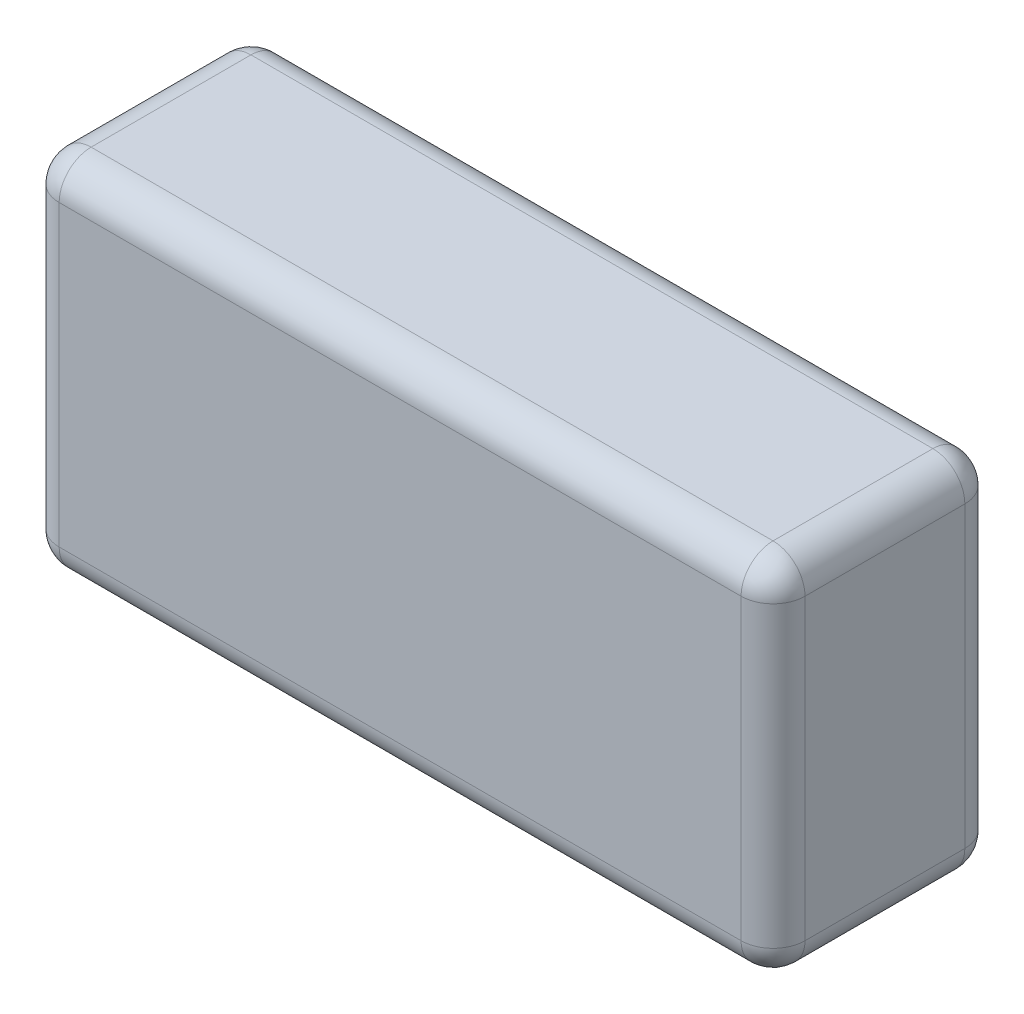
from build123d import *

# Parameters (mm, degrees)
SKETCH_1_W      = 70
SKETCH_1_H      = 21
EXTRUDE_1_DEPTH = 17
FILLET_1_R      = 3


with BuildPart() as part:
    # 草图1 → 凸台-拉伸1 (new, symmetric)
    with BuildSketch(Plane(origin=(0, 0, 0), x_dir=(1, 0, 0), z_dir=(0, 1, 0))):
        Rectangle(SKETCH_1_W, SKETCH_1_H)
    extrude(amount=EXTRUDE_1_DEPTH, both=True)

    # 圆角1
    fillet_1_edges = [part.edges().sort_by_distance(p)[0] for p in [
        (-35, 0, -10.5),
        (0, -17, -10.5),
        (35, 0, -10.5),
        (35, -17, 0),
        (-35, 0, 10.5),
        (35, 0, 10.5),
        (0, -17, 10.5),
        (0, 17, -10.5),
        (35, 17, 0),
        (0, 17, 10.5),
        (-35, 17, 0),
        (-35, -17, 0),
    ]]
    fillet(fillet_1_edges, radius=FILLET_1_R)


solid = part.part
